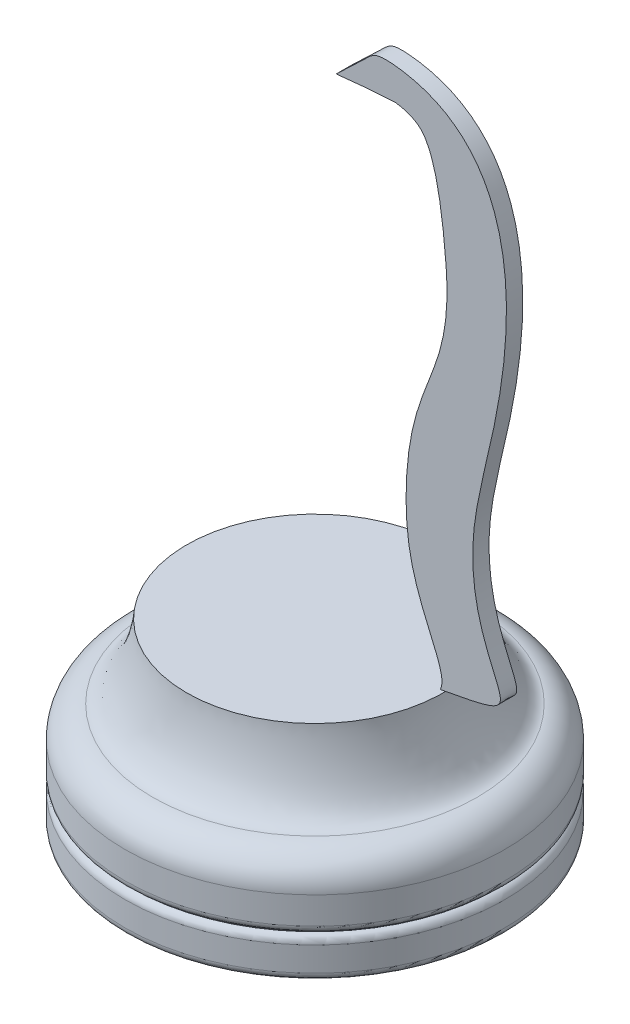
from build123d import *

# Parameters (mm, degrees)
BOSS_EXTRUDE1_DEPTH      = 0.762
BOSS_EXTRUDE1_DEPTH_BACK = 0.762
BOSS_EXTRUDE2_START      = 5.08
SKETCH29_W               = 5.566883853
SKETCH29_H               = 5.997861035
BOSS_EXTRUDE2_DEPTH      = 2.54
BODY_MOVE_COPY1_ANGLE    = 180


with BuildPart() as part:
    # Sketch2 → Revolve2 (revolve)
    with BuildSketch(Plane.XY, mode=Mode.PRIVATE) as revolve2_sk:
        with BuildLine():
            Line((185.0870565, 5.238696339), (185.0870565, 15.273622411))
            Line((185.0870565, 15.273622411), (169.912765925, 15.273622411))
            ThreePointArc((169.912765925, 15.273622411), (168.053057897, 14.308579024), (167.3070565, 12.350696339))
            Line((167.3070565, 12.350696339), (167.3070565, 9.810696339))
            ThreePointArc((167.3070565, 9.810696339), (167.446886106, 9.370755434), (167.8150565, 9.092275849))
            Line((167.8150565, 9.092275849), (167.8150565, 9.005116829))
            ThreePointArc((167.8150565, 9.005116829), (167.446886106, 8.726637244), (167.3070565, 8.286696339))
            Line((167.3070565, 8.286696339), (167.3070565, 6.000696339))
            ThreePointArc((167.3070565, 6.000696339), (167.530241133, 5.461880972), (168.0690565, 5.238696339))
            Line((168.0690565, 5.238696339), (185.0870565, 5.238696339))
        make_face()
    revolve(revolve2_sk.sketch.rotate(Axis((185.0870565, 5.238696339, 0), (0, 1, 0)), 270), axis=Axis((185.0870565, 5.238696339, 0), (0, 1, 0)))

    # Sketch6 → Revolve4 (revolve)
    with BuildSketch(Plane.XY):
        with BuildLine():
            Line((169.912765925, 15.273622411), (185.0870565, 15.273622411))
            Line((185.0870565, 15.273622411), (185.0870565, 22.159647542))
            Line((185.0870565, 22.159647542), (173.082528707, 22.159647542))
            add(Edge.make_bspline(
                [(169.912765925, 15.273622411), (171.90408383, 15.502888972), (172.971663003, 20.443468335), (173.082528707, 22.159647542)],
                knots=[0, 0, 0, 0, 1, 1, 1, 1], degree=3))
        make_face()
    revolve(axis=Axis((185.0870565, 15.273622411, 0), (0, 1, 0)))


with BuildPart() as body_2:
    # Sketch22 → Boss-Extrude1 (new, two sides: drawn at the far end of the back side and taken through both)
    with BuildSketch(Plane.XY.offset(-BOSS_EXTRUDE1_DEPTH_BACK)):
        with BuildLine():
            add(Edge.make_bspline(
                [(172.588941039, 23.059840972), (172.513184543, 23.217532443), (172.424370065, 23.547622554), (172.452492656, 24.354616657), (172.860807378, 25.630050111), (173.720393261, 27.549190026), (174.680715405, 29.867350709), (175.491077162, 32.589692512), (175.841636167, 35.798155723), (175.772543266, 39.030664372), (175.466583219, 41.673269769), (174.978278125, 43.871099197), (174.174530319, 46.371508616), (173.278249233, 48.47999254), (172.546990233, 50.719106168), (172.206813577, 52.287964999), (172.035265805, 53.714747999), (171.964756283, 54.88691249), (171.96144621, 55.96661193), (171.995542492, 56.892364341), (172.026546459, 57.391151881), (172.044662609, 57.635759933)],
                knots=[0.047593809, 0.047593809, 0.047593809, 0.047593809, 0.077356503, 0.107119196, 0.166644583, 0.22616997, 0.285695357, 0.345220744, 0.404746131, 0.464271518, 0.523796905, 0.583322292, 0.642847678, 0.761898452, 0.821423839, 0.880949226, 0.91071192, 0.940474613, 0.970237307, 0.985118653, 1, 1, 1, 1], degree=3))
            add(Edge.make_bspline(
                [(172.044662609, 57.635759933), (172.068254508, 57.954302673), (172.125573649, 58.601071447), (172.245029073, 59.810295074), (172.41205972, 61.213971719), (172.640546689, 62.710571614), (172.985790481, 64.461137278), (173.396628829, 65.843514677), (173.811400848, 66.724633593), (174.066340314, 67.138629612), (174.1919089, 67.307104903), (174.261613105, 67.390886621)],
                knots=[0, 0, 0, 0, 0.0625, 0.125, 0.25, 0.375, 0.5, 0.75, 0.875, 0.9375, 1, 1, 1, 1], degree=3))
            add(Edge.make_bspline(
                [(174.261613105, 67.390886621), (174.387829166, 67.542593374), (174.670550688, 67.803195445), (175.245127404, 68.136209116), (175.929329777, 68.383289406), (176.482119494, 68.495224925), (176.750697299, 68.53306655)],
                knots=[0, 0, 0, 0, 0.12807645, 0.256152899, 0.384229349, 0.512305798, 0.512305798, 0.512305798, 0.512305798], degree=3))
            add(Edge.make_bspline(
                [(176.750697299, 68.53306655), (178.615011391, 68.427808919), (180.481636092, 68.313786886), (182.33413901, 68.079310567)],
                knots=[0.001062302, 0.001062302, 0.001062302, 0.001062302, 0.243568863, 0.243568863, 0.243568863, 0.243568863], degree=3))
            add(Edge.make_bspline(
                [(182.33413901, 68.079310567), (179.253318828, 70.901621937), (179.129308536, 71.796428844), (168.248406041, 70.635386939), (163.750426887, 60.235954079), (171.242761132, 32.657031274), (165.536778704, 24.496044292), (167.516883375, 23.992296018), (172.588941039, 23.059840972)],
                knots=[0, 0, 0, 0, 0.090284477, 0.152793225, 0.57261034, 0.649992792, 0.849235299, 1, 1, 1, 1], degree=3))
        make_face()
    extrude(amount=BOSS_EXTRUDE1_DEPTH + BOSS_EXTRUDE1_DEPTH_BACK)


with BuildPart() as body_3:
    # Sketch29 → Boss-Extrude2 (new body)
    with BuildSketch(Plane.XZ.offset(-5.238696339).offset(BOSS_EXTRUDE2_START)):
        with Locations((187.870498427, -2.998930518)):
            Rectangle(SKETCH29_W, SKETCH29_H)
    extrude(amount=BOSS_EXTRUDE2_DEPTH)


with BuildPart() as part_1:
    # Body-Move/Copy1: moved
    add(part.part.rotate(Axis((185.0870565, 0, 0), (0, 1, 0)), BODY_MOVE_COPY1_ANGLE))


with BuildPart() as body_2_1:
    # Body-Move/Copy1: moved
    add(body_2.part.rotate(Axis((185.0870565, 0, 0), (0, 1, 0)), BODY_MOVE_COPY1_ANGLE))


solid = Compound([body_3.part, part_1.part, body_2_1.part])
